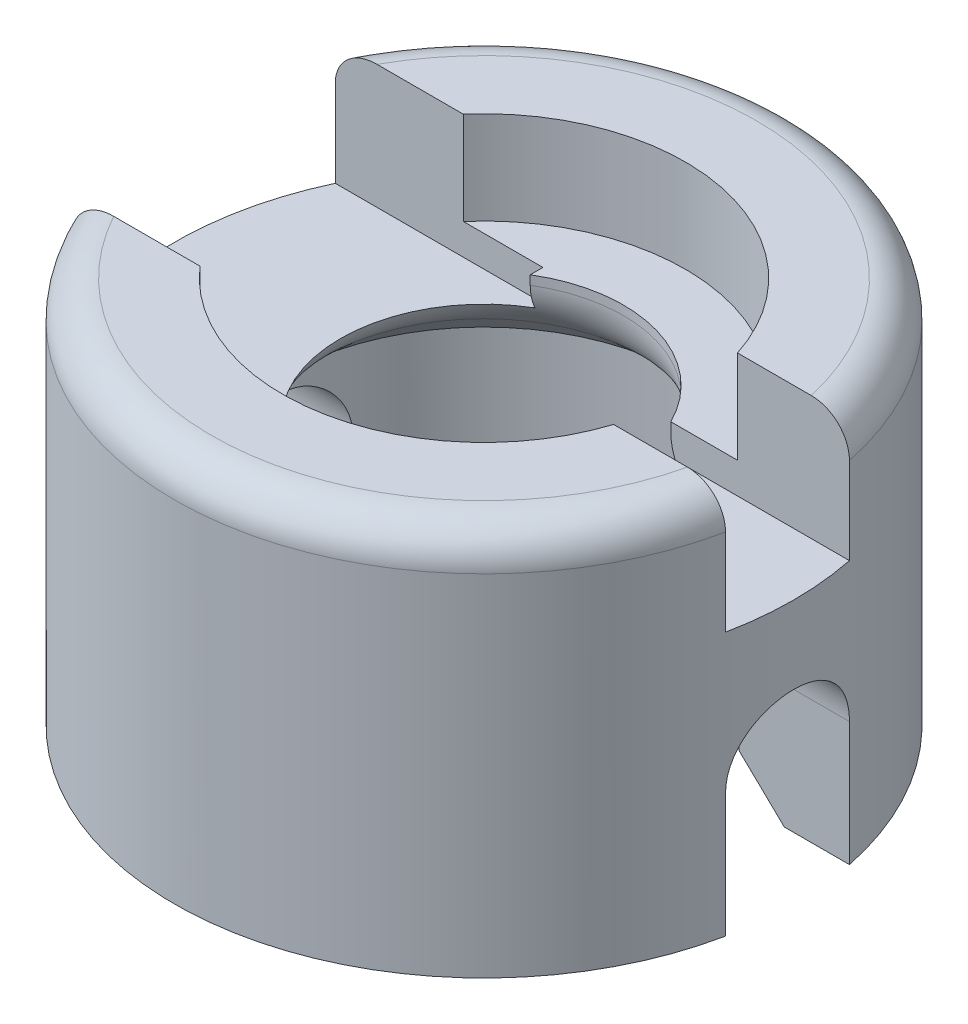
from build123d import *

# Parameters (mm, degrees)
CROQUIS1_R              = 5
CROQUIS1_R_2            = 3.275
SALIENTE_EXTRUIR1_DEPTH = 3.25
CROQUIS3_R              = 5
CROQUIS3_R_2            = 2.25
SALIENTE_EXTRUIR2_DEPTH = 2
REDONDEO1_R             = 0.6
REDONDEO2_R             = 1
CHAFL_N1_SIZE           = 0.7
CHAFL_N2_SIZE           = 0.5
SKETCH1_W               = 13.933828458
SKETCH1_H               = 2
CUT_EXTRUDE1_DEPTH      = 2
SKETCH2_R               = 3.25
CUT_EXTRUDE2_DEPTH      = 1.5
SKETCH3_W               = 17.261868402
SKETCH3_H               = 2
CUT_EXTRUDE3_DEPTH      = 3
CUT_EXTRUDE4_REACH      = 11.437
SKETCH4_W               = 4.736283822
SKETCH4_H               = 4.25
FILLET1_R               = 1


with BuildPart() as part:
    # Croquis1 → Saliente-Extruir1 (new body)
    with BuildSketch(Plane(origin=(0, 0, 0), x_dir=(1, 0, 0), z_dir=(0, 1, 0))):
        with Locations(Location((0, 0, 0), (0, 0, 90))):
            Circle(CROQUIS1_R)
        with Locations(Location((0, 0, 0), (0, 0, 90))):
            Circle(CROQUIS1_R_2, mode=Mode.SUBTRACT)
    extrude(amount=SALIENTE_EXTRUIR1_DEPTH)

    # Croquis2 → Revolución1 (revolve)
    with BuildSketch(Plane.XY, mode=Mode.PRIVATE) as revoluci_n1_sk:
        Polygon((-5, 3.25), (-5, 4.25), (-2.25, 4.25), (-2.25, 4.15), (-3.275, 3.25), align=None)
    revolve(revoluci_n1_sk.sketch.rotate(Axis((0, 0, 0), (0, 1, 0)), 270), axis=Axis((0, 0, 0), (0, 1, 0)))

    # Croquis3 → Saliente-Extruir2 (add)
    with BuildSketch(Plane(origin=(0, 4.25, 0), x_dir=(1, 0, 0), z_dir=(0, 1, 0))):
        with Locations(Location((0, 0, 0), (0, 0, 90))):
            Circle(CROQUIS3_R)
        with Locations(Location((0, 0, 0), (0, 0, 90))):
            Circle(CROQUIS3_R_2, mode=Mode.SUBTRACT)
    extrude(amount=SALIENTE_EXTRUIR2_DEPTH)

    # Redondeo1
    redondeo1_edges = [part.edges().sort_by_distance(p)[0] for p in [
        (0, 6.25, 5),
    ]]
    fillet(redondeo1_edges, radius=REDONDEO1_R)

    # Redondeo2
    redondeo2_edges = [part.edges().sort_by_distance(p)[0] for p in [
        (0, 4.15, 2.25),
    ]]
    fillet(redondeo2_edges, radius=REDONDEO2_R)

    # Chaflán1
    chafl_n1_edges = [part.edges().sort_by_distance(p)[0] for p in [
        (0, 0, 3.275),
    ]]
    chamfer(chafl_n1_edges, length=CHAFL_N1_SIZE)

    # Chaflán2
    chafl_n2_edges = [part.edges().sort_by_distance(p)[0] for p in [
        (0, 6.25, 2.25),
    ]]
    chamfer(chafl_n2_edges, length=CHAFL_N2_SIZE)

    # Sketch1 → Cut-Extrude1 (cut)
    with BuildSketch(Plane(origin=(0, 6.25, 0), x_dir=(1, 0, 0), z_dir=(0, 1, 0))):
        Rectangle(SKETCH1_W, SKETCH1_H)
    extrude(amount=-CUT_EXTRUDE1_DEPTH, mode=Mode.SUBTRACT)

    # Sketch2 → Cut-Extrude2 (cut)
    with BuildSketch(Plane(origin=(0, 6.25, 0), x_dir=(1, 0, 0), z_dir=(0, 1, 0))):
        Circle(SKETCH2_R)
    extrude(amount=-CUT_EXTRUDE2_DEPTH, mode=Mode.SUBTRACT)

    # Sketch3 → Cut-Extrude3 (cut)
    with BuildSketch(Plane.XZ):
        Rectangle(SKETCH3_W, SKETCH3_H)
    extrude(amount=-CUT_EXTRUDE3_DEPTH, mode=Mode.SUBTRACT)

    # Cut-Extrude4: up to this face of the body (flat: up to its plane)
    cut_extrude4_end = Plane(part.part.faces().sort_by_distance((3.602612573, 4.25, -9.08e-07))[0])
    # Sketch4 → Cut-Extrude4 (cut, up to the picked face)
    with BuildSketch(Plane(origin=(0, 6.25, 0), x_dir=(1, 0, 0), z_dir=(0, 1, 0)), mode=Mode.PRIVATE) as cut_extrude4_sk1:
        with Locations((-3.541734363, 0)):
            Rectangle(SKETCH4_W, SKETCH4_H)
    cut_extrude4_tool1 = split(extrude(cut_extrude4_sk1.sketch, amount=-CUT_EXTRUDE4_REACH, mode=Mode.PRIVATE), bisect_by=cut_extrude4_end, keep=Keep.BOTH, mode=Mode.PRIVATE)
    add(cut_extrude4_tool1.solids().sort_by(Axis((-3.541734, 6.25, 0), (0, -1, 0)))[0], mode=Mode.SUBTRACT)

    # Fillet1
    fillet1_edges = [part.edges().sort_by_distance(p)[0] for p in [
        (4.008786459, 3, -1),
        (-4.008786459, 3, -1),
        (4.008786459, 3, 1),
        (-4.008786459, 3, 1),
    ]]
    fillet(fillet1_edges, radius=FILLET1_R - 0.0001)  # a hair under: the kernel refuses the full size


solid = part.part
